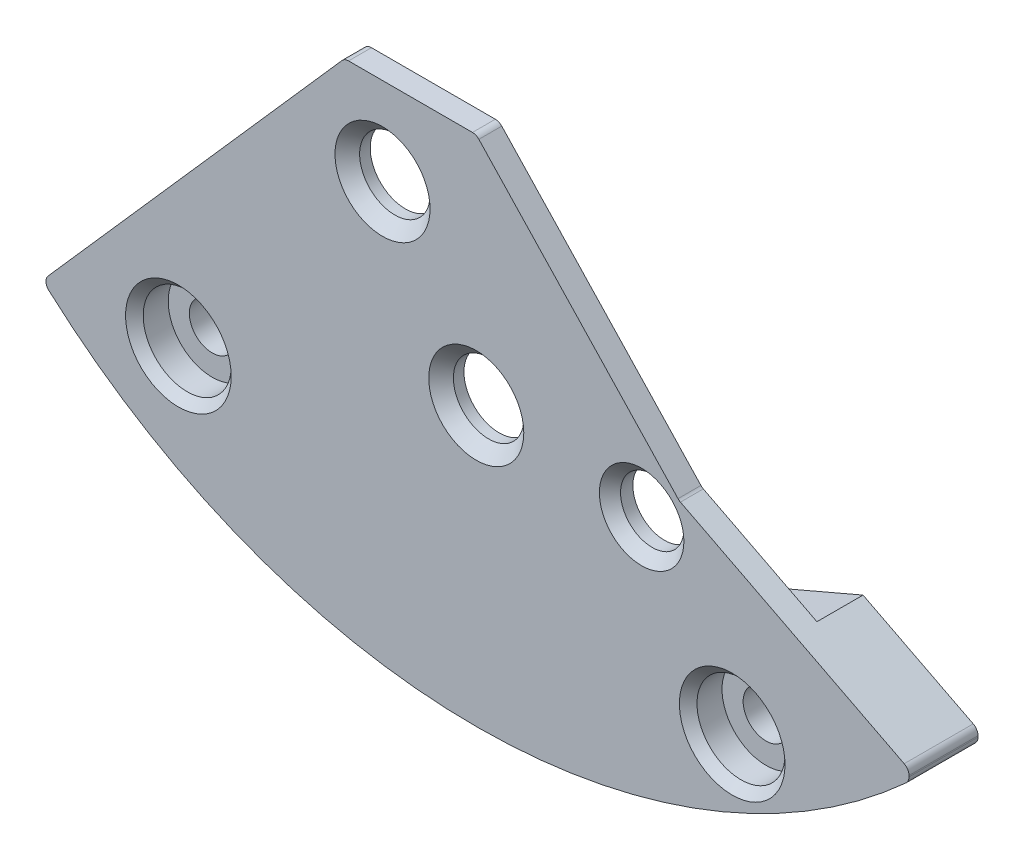
from build123d import *

# Parameters (mm, degrees)
BOSS_EXTRUDE1_DEPTH = 0.65
SKETCH2_W           = 0.65
SKETCH2_H           = 9.465837675
CUT_EXTRUDE1_DEPTH  = 12.29
BOSS_EXTRUDE2_DEPTH = 0.35
BOSS_EXTRUDE3_DEPTH = 0.96
BOSS_EXTRUDE4_DEPTH = 0.96
DRAFT1_START        = 1.31
DRAFT1_DEPTH        = 0.65
DRAFT2_DEPTH        = 1.96
DRAFT2_START        = 1.31
DRAFT2_2_DEPTH      = 0.65
HOLE1_D             = 1.3
HOLE1_CBORE_D       = 2.5
HOLE1_CBORE_DEPTH   = 0.96
HOLE2_D             = 2
HOLE2_DEPTH         = 1.960025
HOLE2_CSINK_D       = 2.7
HOLE2_CSINK_ANGLE   = 90
HOLE3_D             = 1.8
HOLE3_DEPTH         = 1.960025
HOLE3_CSINK_D       = 2.4
HOLE3_CSINK_ANGLE   = 90
CHAMFER1_SIZE       = 0.25
FILLET1_R           = 0.25
FILLET2_R           = 4.6


# Read off the part's stored shape, not the designer's step: Draft1, Draft2
with BuildPart() as part:
    # Sketch1 → Boss-Extrude1 (new body)
    with BuildSketch(Plane.XY.offset(1.96)):
        with BuildLine():
            Line((-3.74, -3.59), (-12.32, -13.328169417))
            ThreePointArc((-12.32, -13.328169417), (-0.020405468, -18.149988529), (12.29, -13.355837675))
            Line((12.29, -13.355837675), (12.29, -3.59))
            Line((12.29, -3.59), (-3.74, -3.59))
        make_face()
    extrude(amount=-BOSS_EXTRUDE1_DEPTH)

    # Sketch2 → Cut-Extrude1 (cut)
    with BuildSketch(Plane(origin=(12.29, 0, 0), x_dir=(0, 0, -1), z_dir=(1, 0, 0))):
        with Locations((-1.635, -8.322918838)):
            Rectangle(SKETCH2_W, SKETCH2_H)
    extrude(amount=-CUT_EXTRUDE1_DEPTH, mode=Mode.SUBTRACT)

    # Sketch3 → Boss-Extrude2 (add)
    with BuildSketch(Plane(origin=(0, 0, 1.31), x_dir=(-1, 0, 0), z_dir=(0, 0, -1))):
        with BuildLine():
            Line((1.143818798, -15.746447607), (8.016709975, -8.444000732))
            Line((8.016709975, -8.444000732), (12.32, -13.328169417))
            ThreePointArc((12.32, -13.328169417), (0.020405468, -18.149988529), (-12.29, -13.355837675))
            Line((-12.29, -13.355837675), (-12.29, -13.055837675))
            Line((-12.29, -13.055837675), (-5.126410253, -13.055837675))
            Line((-5.126410253, -13.055837675), (1.143818798, -15.746447607))
        make_face()
    extrude(amount=BOSS_EXTRUDE2_DEPTH)

    # Sketch4 → Boss-Extrude3 (add)
    with BuildSketch(Plane(origin=(0, 0, 0.96), x_dir=(-1, 0, 0), z_dir=(0, 0, -1))):
        with BuildLine():
            Line((-12.29, -13.055837675), (-5.126410253, -13.055837675))
            Line((-5.126410253, -13.055837675), (-3.369826358, -13.809603133))
            ThreePointArc((-3.369826358, -13.809603133), (-3.436718106, -15.84520854), (-4.497267699, -17.584000775))
            ThreePointArc((-4.497267699, -17.584000775), (-8.655774373, -15.953058328), (-12.29, -13.355837675))
            Line((-12.29, -13.355837675), (-12.29, -13.055837675))
        make_face()
    extrude(amount=BOSS_EXTRUDE3_DEPTH)

    # Sketch5 → Boss-Extrude4 (add)
    with BuildSketch(Plane(origin=(0, 0, 0.96), x_dir=(-1, 0, 0), z_dir=(0, 0, -1))):
        with BuildLine():
            Line((4.563917341, -12.112592905), (8.016709975, -8.444000732))
            Line((8.016709975, -8.444000732), (12.32, -13.328169417))
            ThreePointArc((12.32, -13.328169417), (9.811348174, -15.269575862), (7.003003277, -16.744564644))
            ThreePointArc((7.003003277, -16.744564644), (4.920508914, -14.882988414), (4.563917341, -12.112592905))
        make_face()
    extrude(amount=BOSS_EXTRUDE4_DEPTH)

    # Draft1 outline → Draft1 (add)
    with BuildSketch(Plane.XY.offset(DRAFT1_START)):
        Polygon((0, -13.055837675), (8.909023694, -13.055837675), (0, -3.59), align=None)
    extrude(amount=DRAFT1_DEPTH)

    # Draft2 outline → Draft2 (add)
    with BuildSketch(Plane.XY):
        Polygon((12.29, -13.055837675), (9.025, -11.382918837), (5.126410253, -13.055837675), align=None)
    extrude(amount=DRAFT2_DEPTH)

    # Draft2 2 outline → Draft2 2 (add)
    with BuildSketch(Plane.XY.offset(DRAFT2_START)):
        Polygon((7.820834561, -11.899636721), (9.025, -11.382918837), (5.76, -9.71), align=None)
    extrude(amount=DRAFT2_2_DEPTH)

    # Hole1 (through all)
    with Locations(Plane.XY.offset(1.96)):
        with Locations((7.269383833, -14.700362078), (-8.459801911, -13.019281065)):
            CounterBoreHole(HOLE1_D / 2, HOLE1_CBORE_D / 2, HOLE1_CBORE_DEPTH)

    # Hole2
    with Locations(Plane.XY.offset(1.96)):
        with Locations((0, -10.25), (-2.662261998, -6.0740848)):
            CounterSinkHole(HOLE2_D / 2, HOLE2_CSINK_D / 2, depth=HOLE2_DEPTH, counter_sink_angle=HOLE2_CSINK_ANGLE)

    # Hole3
    with Locations(Plane.XY.offset(1.96)):
        with Locations((4.697017702, -10.646000252)):
            CounterSinkHole(HOLE3_D / 2, HOLE3_CSINK_D / 2, depth=HOLE3_DEPTH, counter_sink_angle=HOLE3_CSINK_ANGLE)

    # Chamfer1
    chamfer1_edges = [part.edges().sort_by_distance(p)[0] for p in [
        (-9.709801911, -13.019281065, 1.96),
        (6.019383833, -14.700362078, 1.96),
    ]]
    chamfer(chamfer1_edges, length=CHAMFER1_SIZE)

    # Fillet1
    fillet1_edges = [part.edges().sort_by_distance(p)[0] for p in [
        (5.76, -9.71, 1.635),
        (-12.32, -13.328169417, 0.98),
        (12.29, -13.055837675, 0.98),
        (12.29, -13.355837675, 0.98),
        (0, -3.59, 1.635),
        (-3.74, -3.59, 1.635),
    ]]
    fillet(fillet1_edges, radius=FILLET1_R)

    # Fillet2
    fillet2_edges = [part.edges().sort_by_distance(p)[0] for p in [
        (-1.143818798, -15.746447607, 1.135),
    ]]
    fillet(fillet2_edges, radius=FILLET2_R)


solid = part.part
